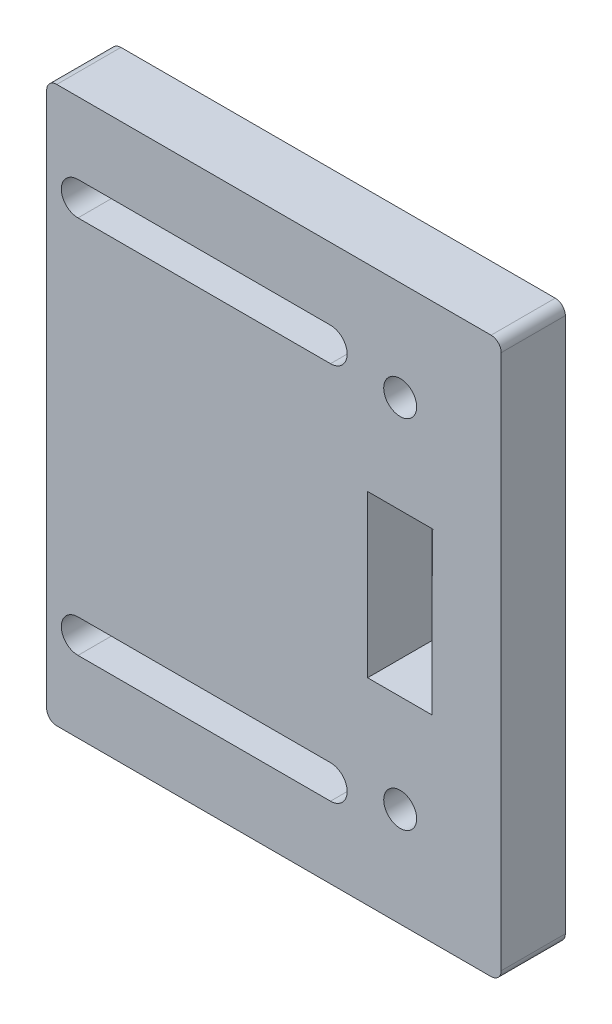
from build123d import *

# Parameters (mm, degrees)
SKETCH1_W                                        = 90
SKETCH1_H                                        = 110
BOSS_EXTRUDE2_DEPTH                              = 12.7
CSK_FOR_1_4_FLAT_HEAD_MACHINE_SCREW3_D           = 6.5278
CSK_FOR_1_4_FLAT_HEAD_MACHINE_SCREW3_CSINK_D     = 12.8778
CSK_FOR_1_4_FLAT_HEAD_MACHINE_SCREW3_CSINK_ANGLE = 82
CSK_FOR_1_4_FLAT_HEAD_MACHINE_SCREW4_D           = 6.5278
CSK_FOR_1_4_FLAT_HEAD_MACHINE_SCREW4_CSINK_D     = 12.8778
CSK_FOR_1_4_FLAT_HEAD_MACHINE_SCREW4_CSINK_ANGLE = 82
FILLET1_R                                        = 2
CUT_EXTRUDE1_DEPTH                               = 143.692992119


with BuildPart() as part:
    # Sketch1 → Boss-Extrude2 (new body)
    with BuildSketch(Plane.XY):
        with Locations((45, -55)):
            Rectangle(SKETCH1_W, SKETCH1_H)
        Polygon((70, -39.025625978), (76.45, -39.025625978), (76.25, -55), (76.25, -70.975625978), (70, -70.975625978), (63.55, -70.975625978), (63.55, -39.025625978), align=None, mode=Mode.SUBTRACT)
    extrude(amount=BOSS_EXTRUDE2_DEPTH)

    # CSK for 1/4 Flat Head Machine Screw3 (through all)
    with Locations(Plane(origin=(0, 0, 0), x_dir=(-1, 0, 0), z_dir=(0, 0, -1))):
        with Locations((-70, -90.31)):
            CounterSinkHole(CSK_FOR_1_4_FLAT_HEAD_MACHINE_SCREW3_D / 2, CSK_FOR_1_4_FLAT_HEAD_MACHINE_SCREW3_CSINK_D / 2, counter_sink_angle=CSK_FOR_1_4_FLAT_HEAD_MACHINE_SCREW3_CSINK_ANGLE)

    # CSK for 1/4 Flat Head Machine Screw4 (through all)
    with Locations(Plane(origin=(0, 0, 0), x_dir=(-1, 0, 0), z_dir=(0, 0, -1))):
        with Locations((-70, -19.69)):
            CounterSinkHole(CSK_FOR_1_4_FLAT_HEAD_MACHINE_SCREW4_D / 2, CSK_FOR_1_4_FLAT_HEAD_MACHINE_SCREW4_CSINK_D / 2, counter_sink_angle=CSK_FOR_1_4_FLAT_HEAD_MACHINE_SCREW4_CSINK_ANGLE)

    # Fillet1
    fillet1_edges = [part.edges().sort_by_distance(p)[0] for p in [
        (0, 0, 6.35),
        (90, 0, 6.35),
        (0, -110, 6.35),
        (90, -110, 6.35),
    ]]
    fillet(fillet1_edges, radius=FILLET1_R)

    # Sketch15 → Cut-Extrude1 (cut, through all)
    with BuildSketch(Plane(origin=(0, 0, 0), x_dir=(-1, 0, 0), z_dir=(0, 0, -1))):
        with BuildLine():
            Line((-56.200253658, -14.19), (-6.200253658, -14.19))
            ThreePointArc((-6.200253658, -14.19), (-2.900253658, -17.49), (-6.200253658, -20.79))
            Line((-6.200253658, -20.79), (-56.200253658, -20.79))
            ThreePointArc((-56.200253658, -20.79), (-59.500253658, -17.49), (-56.200253658, -14.19))
        make_face()
        with BuildLine():
            Line((-56.200253658, -89.21), (-6.200253658, -89.21))
            ThreePointArc((-6.200253658, -89.21), (-2.900253658, -92.51), (-6.200253658, -95.81))
            Line((-6.200253658, -95.81), (-56.200253658, -95.81))
            ThreePointArc((-56.200253658, -95.81), (-59.500253658, -92.51), (-56.200253658, -89.21))
        make_face()
    extrude(amount=-CUT_EXTRUDE1_DEPTH, mode=Mode.SUBTRACT)


solid = part.part
